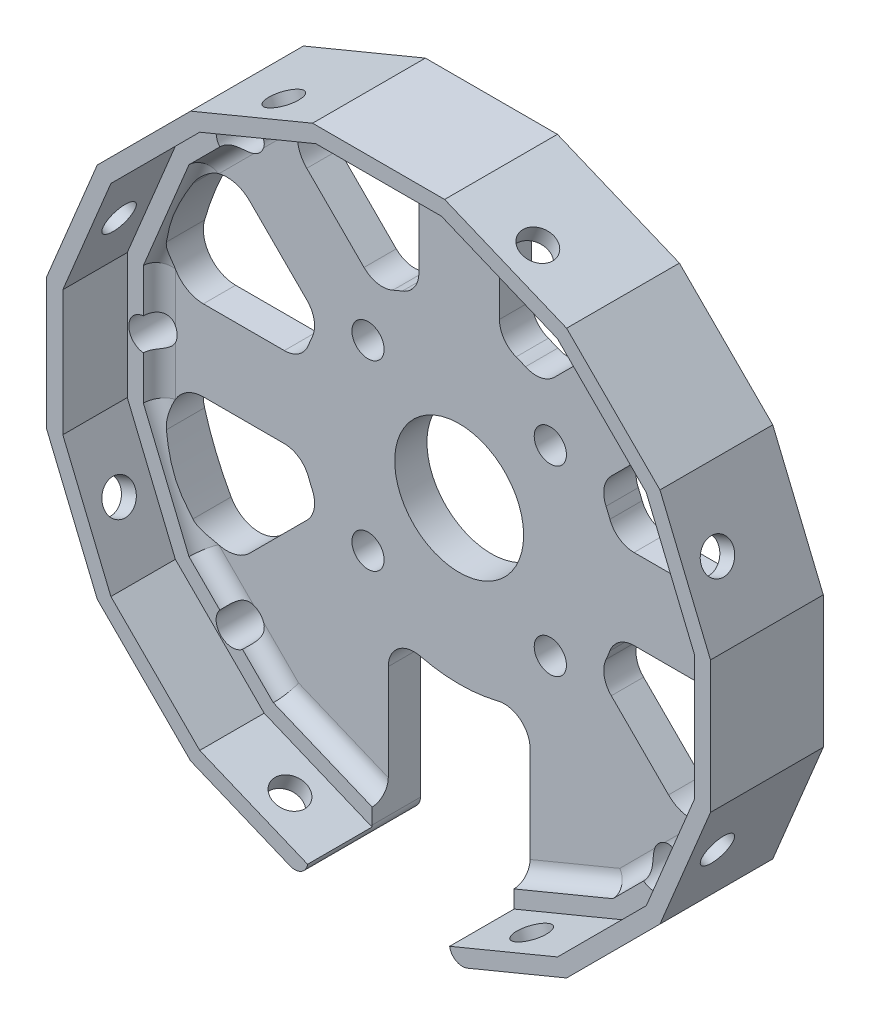
from build123d import *

# Parameters (mm, degrees)
SKETCH1_R             = 10
BOSS_EXTRUDE6_DEPTH   = 5
BOSS_EXTRUDE7_DEPTH   = 12.5
BOSS_EXTRUDE8_DEPTH   = 2.5
FILLET1_R             = 2.5
F_5_0MM_DOWEL_HOLE4_D = 5
F_5_0MM_DOWEL_HOLE3_D = 5
CIRPATTERN1_COUNT     = 4
CIRPATTERN2_COUNT     = 8
SKETCH3_R             = 2.5
CUT_EXTRUDE2_DEPTH    = 75.892876574
FILLET2_R             = 5
FILLET3_R             = 4
CIRPATTERN4_COUNT     = 8
FILLET5_R             = 2


with BuildPart() as part:
    # Sketch1 → Boss-Extrude6 (new body)
    # profile 1 of 3: a face of its own
    with BuildSketch(Plane.XY):
        Polygon((43.652154646, -29.167437234), (51.491227221, -10.242241906), (51.491227221, 10.242241906), (43.652154646, 29.167437234), (29.167437234, 43.652154646), (10.242241906, 51.491227221), (-10.242241906, 51.491227221), (-29.167437234, 43.652154646), (-43.652154646, 29.167437234), (-51.491227221, 10.242241906), (-51.491227221, -10.242241906), (-43.652154646, -29.167437234), (-29.167437234, -43.652154646), (-10.242241906, -51.491227221), (10.242241906, -51.491227221), (29.167437234, -43.652154646), align=None)
        Polygon((9.744960987, 48.991227221), (-9.744960987, 48.991227221), (-27.75130099, 41.532756983), (-41.532756983, 27.75130099), (-48.991227221, 9.744960987), (-48.991227221, -9.744960987), (-41.532756983, -27.75130099), (-27.75130099, -41.532756983), (-9.744960987, -48.991227221), (9.744960987, -48.991227221), (27.75130099, -41.532756983), (41.532756983, -27.75130099), (48.991227221, -9.744960987), (48.991227221, 9.744960987), (41.532756983, 27.75130099), (27.75130099, 41.532756983), align=None, mode=Mode.SUBTRACT)
    # profile 2 of 3: a face of its own
    with BuildSketch(Plane.XY):
        Polygon((27.75130099, 41.532756983), (9.744960987, 48.991227221), (-9.744960987, 48.991227221), (-27.75130099, 41.532756983), (-41.532756983, 27.75130099), (-48.991227221, 9.744960987), (-48.991227221, -9.744960987), (-41.532756983, -27.75130099), (-27.75130099, -41.532756983), (-9.744960987, -48.991227221), (9.744960987, -48.991227221), (27.75130099, -41.532756983), (41.532756983, -27.75130099), (48.991227221, -9.744960987), (48.991227221, 9.744960987), (41.532756983, 27.75130099), align=None)
        Polygon((9.247680069, 46.491227221), (-9.247680069, 46.491227221), (-26.335164747, 39.413359321), (-39.413359321, 26.335164747), (-46.491227221, 9.247680069), (-46.491227221, -9.247680069), (-39.413359321, -26.335164747), (-26.335164747, -39.413359321), (-9.247680069, -46.491227221), (9.247680069, -46.491227221), (26.335164747, -39.413359321), (39.413359321, -26.335164747), (46.491227221, -9.247680069), (46.491227221, 9.247680069), (39.413359321, 26.335164747), (26.335164747, 39.413359321), align=None, mode=Mode.SUBTRACT)
    # profile 3 of 3: a face of its own
    with BuildSketch(Plane.XY):
        Polygon((26.335164747, 39.413359321), (9.247680069, 46.491227221), (-9.247680069, 46.491227221), (-26.335164747, 39.413359321), (-39.413359321, 26.335164747), (-46.491227221, 9.247680069), (-46.491227221, -9.247680069), (-39.413359321, -26.335164747), (-26.335164747, -39.413359321), (-9.247680069, -46.491227221), (9.247680069, -46.491227221), (26.335164747, -39.413359321), (39.413359321, -26.335164747), (46.491227221, -9.247680069), (46.491227221, 9.247680069), (39.413359321, 26.335164747), align=None)
        Circle(SKETCH1_R, mode=Mode.SUBTRACT)
    extrude(amount=-BOSS_EXTRUDE6_DEPTH)

    # Sketch1<9> → Boss-Extrude7 (add)
    with BuildSketch(Plane.XY):
        Polygon((43.652154646, -29.167437234), (51.491227221, -10.242241906), (51.491227221, 10.242241906), (43.652154646, 29.167437234), (29.167437234, 43.652154646), (10.242241906, 51.491227221), (-10.242241906, 51.491227221), (-29.167437234, 43.652154646), (-43.652154646, 29.167437234), (-51.491227221, 10.242241906), (-51.491227221, -10.242241906), (-43.652154646, -29.167437234), (-29.167437234, -43.652154646), (-10.242241906, -51.491227221), (10.242241906, -51.491227221), (29.167437234, -43.652154646), align=None)
        Polygon((9.744960987, 48.991227221), (-9.744960987, 48.991227221), (-27.75130099, 41.532756983), (-41.532756983, 27.75130099), (-48.991227221, 9.744960987), (-48.991227221, -9.744960987), (-41.532756983, -27.75130099), (-27.75130099, -41.532756983), (-9.744960987, -48.991227221), (9.744960987, -48.991227221), (27.75130099, -41.532756983), (41.532756983, -27.75130099), (48.991227221, -9.744960987), (48.991227221, 9.744960987), (41.532756983, 27.75130099), (27.75130099, 41.532756983), align=None, mode=Mode.SUBTRACT)
    extrude(amount=BOSS_EXTRUDE7_DEPTH)

    # Sketch1<10> → Boss-Extrude8 (add)
    with BuildSketch(Plane.XY):
        Polygon((27.75130099, 41.532756983), (9.744960987, 48.991227221), (-9.744960987, 48.991227221), (-27.75130099, 41.532756983), (-41.532756983, 27.75130099), (-48.991227221, 9.744960987), (-48.991227221, -9.744960987), (-41.532756983, -27.75130099), (-27.75130099, -41.532756983), (-9.744960987, -48.991227221), (9.744960987, -48.991227221), (27.75130099, -41.532756983), (41.532756983, -27.75130099), (48.991227221, -9.744960987), (48.991227221, 9.744960987), (41.532756983, 27.75130099), align=None)
        Polygon((9.247680069, 46.491227221), (-9.247680069, 46.491227221), (-26.335164747, 39.413359321), (-39.413359321, 26.335164747), (-46.491227221, 9.247680069), (-46.491227221, -9.247680069), (-39.413359321, -26.335164747), (-26.335164747, -39.413359321), (-9.247680069, -46.491227221), (9.247680069, -46.491227221), (26.335164747, -39.413359321), (39.413359321, -26.335164747), (46.491227221, -9.247680069), (46.491227221, 9.247680069), (39.413359321, 26.335164747), (26.335164747, 39.413359321), align=None, mode=Mode.SUBTRACT)
    extrude(amount=BOSS_EXTRUDE8_DEPTH)

    # Fillet1
    fillet1_edges = [part.edges().sort_by_distance(p)[0] for p in [
        (-17.791422408, 42.952293271, 0),
        (0, 46.491227221, 0),
        (17.791422408, 42.952293271, 0),
        (32.874262034, 32.874262034, 0),
        (42.952293271, 17.791422408, 0),
        (46.491227221, 0, 0),
        (42.952293271, -17.791422408, 0),
        (32.874262034, -32.874262034, 0),
        (17.791422408, -42.952293271, 0),
        (0, -46.491227221, 0),
        (-17.791422408, -42.952293271, 0),
        (-32.874262034, -32.874262034, 0),
        (-42.952293271, -17.791422408, 0),
        (-46.491227221, 0, 0),
        (-32.874262034, 32.874262034, 0),
        (-42.952293271, 17.791422408, 0),
    ]]
    fillet(fillet1_edges, radius=FILLET1_R - 0.0001)  # a hair under: the kernel refuses the full size

    # Ø5.0mm Dowel Hole4 (through all)
    with Locations(Plane(origin=(0, 0, -5), x_dir=(-1, 0, 0), z_dir=(0, 0, -1))):
        with Locations((14.142135624, 14.142135624)):
            f_5_0mm_dowel_hole4 = Hole(F_5_0MM_DOWEL_HOLE4_D / 2)

    # Ø5.0mm Dowel Hole3 (through all)
    with Locations(Plane(origin=(0, 0, -5), x_dir=(-1, 0, 0), z_dir=(0, 0, -1))):
        with Locations((46.25, 0)):
            f_5_0mm_dowel_hole3 = Hole(F_5_0MM_DOWEL_HOLE3_D / 2)

    # CirPattern1: Ø5.0mm Dowel Hole4 ×4 about axis
    cirpattern1_axis = Axis((0, 0, 0), (0, 0, 1))
    for i in range(1, CIRPATTERN1_COUNT):
        add(f_5_0mm_dowel_hole4.rotate(cirpattern1_axis, i * 360 / CIRPATTERN1_COUNT), mode=Mode.SUBTRACT)

    # CirPattern2: Ø5.0mm Dowel Hole3 ×8 about axis
    cirpattern2_axis = Axis((0, 0, 0), (0, 0, 1))
    for i in range(1, CIRPATTERN2_COUNT):
        add(f_5_0mm_dowel_hole3.rotate(cirpattern2_axis, i * 360 / CIRPATTERN2_COUNT), mode=Mode.SUBTRACT)

    # Sketch3 → Cut-Extrude2 (cut, through all)
    # profile 1 of 7: a face of its own
    with BuildSketch(Plane(origin=(0, 0, -5), x_dir=(-1, 0, 0), z_dir=(0, 0, -1))):
        with BuildLine():
            ThreePointArc((21.535747304, 12.69691254), (23.096988313, 9.567085809), (24.206145914, 6.25))
            Line((24.206145914, 6.25), (45.82575695, 6.25))
            ThreePointArc((45.82575695, 6.25), (42.729428379, 17.699108747), (36.823120874, 27.98428611))
            Line((36.823120874, 27.98428611), (21.535747304, 12.69691254))
        make_face()
    # profile 2 of 7: a face of its own
    with BuildSketch(Plane(origin=(0, 0, -5), x_dir=(-1, 0, 0), z_dir=(0, 0, -1))):
        with BuildLine():
            Line((45.82575695, -6.25), (24.206145914, -6.25))
            ThreePointArc((24.206145914, -6.25), (23.096988313, -9.567085809), (21.535747304, -12.69691254))
            Line((21.535747304, -12.69691254), (36.823120874, -27.98428611))
            ThreePointArc((36.823120874, -27.98428611), (42.729428379, -17.699108747), (45.82575695, -6.25))
        make_face()
    # profile 3 of 7: a face of its own
    with BuildSketch(Plane(origin=(0, 0, -5), x_dir=(-1, 0, 0), z_dir=(0, 0, -1))):
        with BuildLine():
            ThreePointArc((6.25, 24.206145914), (9.567085809, 23.096988313), (12.69691254, 21.535747304))
            Line((12.69691254, 21.535747304), (27.98428611, 36.823120874))
            ThreePointArc((27.98428611, 36.823120874), (17.699108747, 42.729428379), (6.25, 45.82575695))
            Line((6.25, 45.82575695), (6.25, 24.206145914))
        make_face()
    # profile 4 of 7: a face of its own
    with BuildSketch(Plane(origin=(0, 0, -5), x_dir=(-1, 0, 0), z_dir=(0, 0, -1))):
        with BuildLine():
            ThreePointArc((-12.69691254, 21.535747304), (-9.567085809, 23.096988313), (-6.25, 24.206145914))
            Line((-6.25, 24.206145914), (-6.25, 45.82575695))
            ThreePointArc((-6.25, 45.82575695), (-17.699108747, 42.729428379), (-27.98428611, 36.823120874))
            Line((-27.98428611, 36.823120874), (-12.69691254, 21.535747304))
        make_face()
    # profile 5 of 7: a face of its own
    with BuildSketch(Plane(origin=(0, 0, -5), x_dir=(-1, 0, 0), z_dir=(0, 0, -1))):
        with BuildLine():
            ThreePointArc((11, -22.449944321), (0, -25), (-11, -22.449944321))
            Line((-11, -22.449944321), (-11, -51.177353542))
            Line((-11, -51.177353542), (-10.242241906, -51.491227221))
            Line((-10.242241906, -51.491227221), (10.242241906, -51.491227221))
            Line((10.242241906, -51.491227221), (11, -51.177353542))
            Line((11, -51.177353542), (11, -22.449944321))
        make_face()
        with Locations((0, -46.25)):
            Circle(SKETCH3_R, mode=Mode.SUBTRACT)
    # profile 6 of 7: a face of its own
    with BuildSketch(Plane(origin=(0, 0, -5), x_dir=(-1, 0, 0), z_dir=(0, 0, -1))):
        with BuildLine():
            ThreePointArc((-24.206145914, 6.25), (-23.096988313, 9.567085809), (-21.535747304, 12.69691254))
            Line((-21.535747304, 12.69691254), (-36.823120874, 27.98428611))
            ThreePointArc((-36.823120874, 27.98428611), (-42.729428379, 17.699108747), (-45.82575695, 6.25))
            Line((-45.82575695, 6.25), (-24.206145914, 6.25))
        make_face()
    # profile 7 of 7: a face of its own
    with BuildSketch(Plane(origin=(0, 0, -5), x_dir=(-1, 0, 0), z_dir=(0, 0, -1))):
        with BuildLine():
            ThreePointArc((-21.535747304, -12.69691254), (-23.096988313, -9.567085809), (-24.206145914, -6.25))
            Line((-24.206145914, -6.25), (-45.82575695, -6.25))
            ThreePointArc((-45.82575695, -6.25), (-42.729428379, -17.699108747), (-36.823120874, -27.98428611))
            Line((-36.823120874, -27.98428611), (-21.535747304, -12.69691254))
        make_face()
    extrude(amount=-CUT_EXTRUDE2_DEPTH, mode=Mode.SUBTRACT)

    # Fillet2
    fillet2_edges = [part.edges().sort_by_distance(p)[0] for p in [
        (36.823120874, -27.98428611, -2.099221299),
        (45.82575695, -6.25, -2.099221299),
        (45.82575695, 6.25, -2.099221299),
        (36.823120874, 27.98428611, -2.099221299),
        (27.98428611, 36.823120874, -2.099221299),
        (6.25, 45.82575695, -2.099221299),
        (-6.25, 45.82575695, -2.099221299),
        (-27.98428611, 36.823120874, -2.099221299),
        (-36.823120874, 27.98428611, -2.099221299),
        (-45.82575695, 6.25, -2.099221299),
        (-36.823120874, -27.98428611, -2.099221299),
        (-45.82575695, -6.25, -2.099221299),
    ]]
    fillet(fillet2_edges, radius=FILLET2_R)

    # Fillet3
    fillet3_edges = [part.edges().sort_by_distance(p)[0] for p in [
        (24.206145914, -6.25, -2.5),
        (21.535747304, -12.69691254, -2.5),
        (11, -22.449944321, -2.5),
        (-11, -22.449944321, -2.5),
        (-21.535747304, -12.69691254, -2.5),
        (-24.206145914, -6.25, -2.5),
        (-24.206145914, 6.25, -2.5),
        (-21.535747304, 12.69691254, -2.5),
        (-12.69691254, 21.535747304, -2.5),
        (-6.25, 24.206145914, -2.5),
        (6.25, 24.206145914, -2.5),
        (12.69691254, 21.535747304, -2.5),
        (21.535747304, 12.69691254, -2.5),
        (24.206145914, 6.25, -2.5),
    ]]
    fillet(fillet3_edges, radius=FILLET3_R)

    # Sketch14 → Ø5.0mm Dowel Hole5 (revolve, cut)
    with BuildSketch(Plane(origin=(47.571690934, 19.70483957, 7.5), x_dir=(-0.38268343236509017, 0.9238795325112867, 0), z_dir=(0, 0, 1))):
        Polygon((0, 0), (0, 4.002151548), (2.5, 2.5), (2.5, 0), align=None)
    f_5_0mm_dowel_hole5 = revolve(axis=Axis((53.438325965, 22.134879365, 7.5), (-0.9238795325112866, -0.3826834323650901, 0)), mode=Mode.SUBTRACT)

    # CirPattern4: Ø5.0mm Dowel Hole5 ×8 about axis
    cirpattern4_axis = Axis((0, 0, 1000), (0, 0, -1))
    for i in range(1, CIRPATTERN4_COUNT):
        add(f_5_0mm_dowel_hole5.rotate(cirpattern4_axis, i * 360 / CIRPATTERN4_COUNT), mode=Mode.SUBTRACT)

    # Fillet5
    fillet5_edges = [part.edges().sort_by_distance(p)[0] for p in [
        (11, -51.177353542, 3.75),
        (-11, -51.177353542, 3.75),
    ]]
    fillet(fillet5_edges, radius=FILLET5_R)


solid = part.part
